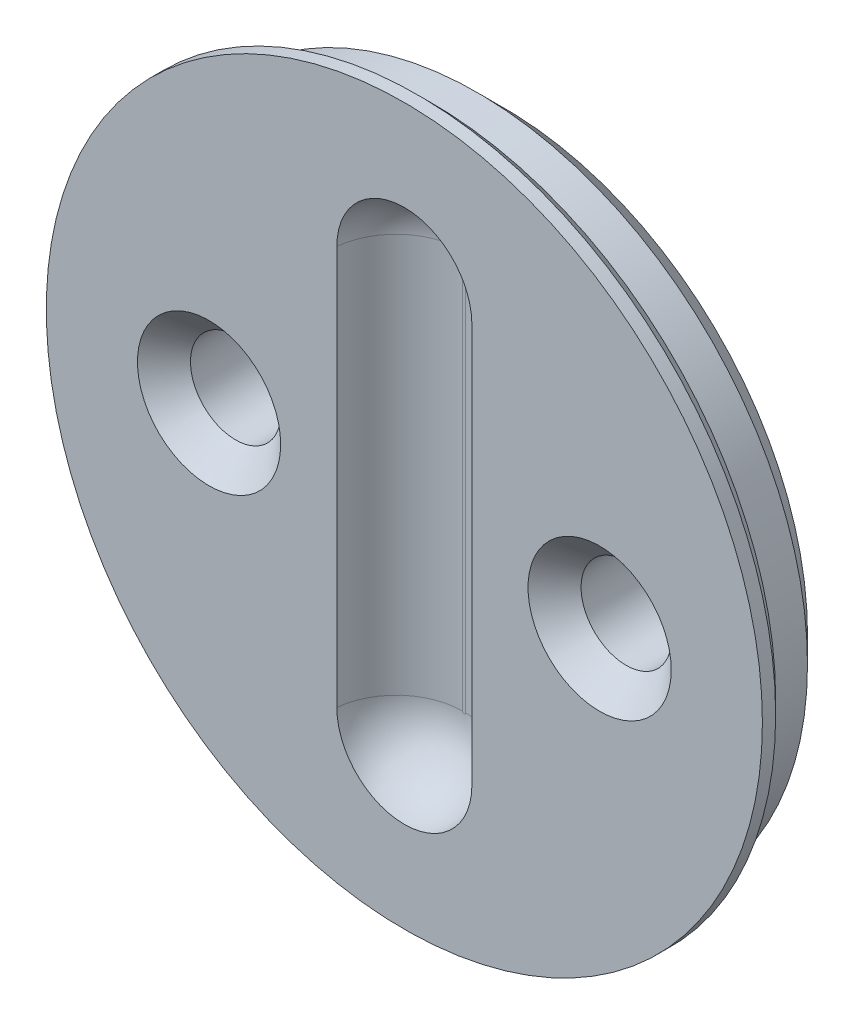
from build123d import *

# Parameters (mm, degrees)
SKETCH1_R           = 12.45
SKETCH1_R_2         = 1.7
BOSS_EXTRUDE1_DEPTH = 2.75
SKETCH2_W           = 7.7
SKETCH2_H           = 6.7
BOSS_EXTRUDE2_DEPTH = 3.5
BOSS_EXTRUDE3_START = 1
SKETCH3_R           = 13.5
SKETCH3_R_2         = 1.7
BOSS_EXTRUDE3_DEPTH = 1
CHAMFER1_SIZE       = 1
CHAMFER2_SIZE       = 0.5
CUT_EXTRUDE1_DEPTH  = 2.25
FILLET1_R           = 2.5
CHAMFER3_SIZE       = 1


with BuildPart() as part:
    # Sketch1 → Boss-Extrude1 (new body)
    with BuildSketch(Plane.XY):
        Circle(SKETCH1_R)
        with Locations((-7.36300717, 0)):
            Circle(SKETCH1_R_2, mode=Mode.SUBTRACT)
        with Locations(Location((7.36300717, 0, 0), (0, 0, 180))):
            Circle(SKETCH1_R_2, mode=Mode.SUBTRACT)
    extrude(amount=-BOSS_EXTRUDE1_DEPTH)

    # Sketch2 → Boss-Extrude2 (add)
    with BuildSketch(Plane(origin=(0, 0, -2.75), x_dir=(-1, 0, 0), z_dir=(0, 0, -1))):
        Rectangle(SKETCH2_W, SKETCH2_H)
    extrude(amount=BOSS_EXTRUDE2_DEPTH)

    # Sketch3 → Boss-Extrude3 (add)
    with BuildSketch(Plane.XY.offset(BOSS_EXTRUDE3_START)):
        Circle(SKETCH3_R)
        with Locations((-7.36300717, 0)):
            Circle(SKETCH3_R_2, mode=Mode.SUBTRACT)
        with Locations((7.36300717, 0)):
            Circle(SKETCH3_R_2, mode=Mode.SUBTRACT)
    extrude(amount=-BOSS_EXTRUDE3_DEPTH)

    # Chamfer1
    chamfer1_edges = [part.edges().sort_by_distance(p)[0] for p in [
        (-3.85, 0, -6.25),
        (0, 3.35, -6.25),
        (3.85, 0, -6.25),
        (0, -3.35, -6.25),
        (-12.45, 0, -2.75),
    ]]
    chamfer(chamfer1_edges, length=CHAMFER1_SIZE)

    # Chamfer2
    chamfer2_edges = [part.edges().sort_by_distance(p)[0] for p in [
        (-13.5, 0, 0),
    ]]
    chamfer(chamfer2_edges, length=CHAMFER2_SIZE)

    # Sketch4 → Cut-Extrude1 (cut)
    with BuildSketch(Plane.XY.offset(1)):
        with BuildLine():
            Line((2.54627648, 7.525661596), (2.54627648, -7.525661596))
            ThreePointArc((2.54627648, -7.525661596), (0, -10.071938075), (-2.54627648, -7.525661596))
            Line((-2.54627648, -7.525661596), (-2.54627648, 7.525661596))
            ThreePointArc((-2.54627648, 7.525661596), (0, 10.071938075), (2.54627648, 7.525661596))
        make_face()
    extrude(amount=-CUT_EXTRUDE1_DEPTH, mode=Mode.SUBTRACT)

    # Fillet1
    # the kernel refuses this fillet: 2.5 mm, written as the material it adds along each edge
    with BuildSketch(Plane(origin=(-2.54627648, -7.525661596, -1.25), x_dir=(0, 0, 1), z_dir=(0, 1, 0)), Plane(origin=(2.54627648, 7.525661596, -1.25), x_dir=(0, 0, 1), z_dir=(0, -1, 0))) as fillet1_piece_1:
        with BuildLine():
            CenterArc((2.5, 2.487468593), FILLET1_R, 180, 84.260829523)
            Line((0, 2.487468593), (-0.05, 2.487468593))
            Line((-0.05, 2.487468593), (-0.05, 0))
            Line((-0.05, 0), (0, -0.05))
            ThreePointArc((0, -0.05), (1.125, -0.05), (2.245, -0.049749372))
            Line((2.245, -0.049749372), (2.25, 0))
        make_face()
    extrude(amount=15.051323191)
    with BuildSketch(Plane(origin=(0, 7.525661596, -1.25), x_dir=(-1, 0, 0), z_dir=(0, -1, 0))) as fillet1_piece_2:
        with BuildLine():
            CenterArc((0.058807887, -2.5), FILLET1_R, 5.739170477, 84.260829523)
            Line((0.058807887, 0), (0.058807887, 0.05))
            Line((0.058807887, 0.05), (2.54627648, 0.05))
            Line((2.54627648, 0.05), (2.59627648, 0))
            ThreePointArc((2.59627648, 0), (2.59627648, -1.125), (2.596025852, -2.245))
            Line((2.596025852, -2.245), (2.54627648, -2.25))
        make_face()
    revolve(axis=Axis((0, 7.525661596, -1.25), (0, 0, -1)), revolution_arc=180)
    with BuildSketch(Plane(origin=(0, -7.525661596, -1.25), x_dir=(1, 0, 0), z_dir=(0, 1, 0))) as fillet1_piece_3:
        with BuildLine():
            CenterArc((0.058807887, -2.5), FILLET1_R, 5.739170477, 84.260829523)
            Line((0.058807887, 0), (0.058807887, 0.05))
            Line((0.058807887, 0.05), (2.54627648, 0.05))
            Line((2.54627648, 0.05), (2.59627648, 0))
            ThreePointArc((2.59627648, 0), (2.59627648, -1.125), (2.596025852, -2.245))
            Line((2.596025852, -2.245), (2.54627648, -2.25))
        make_face()
    revolve(axis=Axis((0, -7.525661596, -1.25), (0, 0, -1)), revolution_arc=180)

    # Chamfer3
    # the kernel refuses this chamfer: 1 mm, written as the material it takes off along each edge
    with BuildSketch(Plane(origin=(-7.36300717, 0, 1), x_dir=(1, 0, 0), z_dir=(0, -1, 0))) as chamfer3_piece_1:
        Polygon((1.7 + CHAMFER3_SIZE, 0), (1.7, -CHAMFER3_SIZE), (1.7, 0), align=None)
    revolve(axis=Axis((-7.36300717, 0, 1), (0, 0, 1)), mode=Mode.SUBTRACT)
    with BuildSketch(Plane(origin=(7.36300717, 0, 1), x_dir=(1, 0, 0), z_dir=(0, -1, 0))) as chamfer3_piece_2:
        Polygon((1.7 + CHAMFER3_SIZE, 0), (1.7, -CHAMFER3_SIZE), (1.7, 0), align=None)
    revolve(axis=Axis((7.36300717, 0, 1), (0, 0, 1)), mode=Mode.SUBTRACT)


solid = part.part
